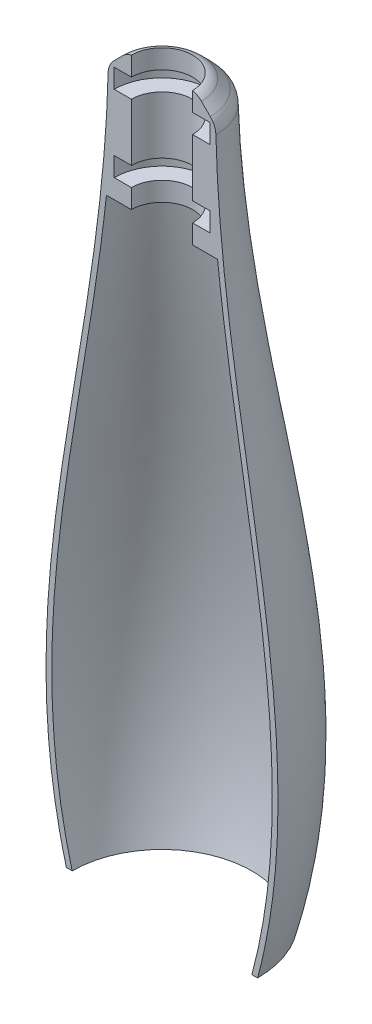
from build123d import *

# Parameters (mm, degrees)
CORTAR_EXTRUIR1_DEPTH      = 70
CORTAR_EXTRUIR1_DEPTH_BACK = 70
CROQUIS2_W                 = 77.259476102
CROQUIS2_H                 = 391.167224263
CHAFL_N1_SIZE              = 10
REDONDEO1_R                = 10


with BuildPart() as part:
    # Croquis1 → Revolución1 (revolve)
    with BuildSketch(Plane.XY):
        with BuildLine():
            Line((-28, 35), (-16, 35))
            Line((-16, 35), (-16, 25))
            Line((-16, 25), (-25, 25))
            Line((-25, 25), (-25, 15))
            Line((-25, 15), (-16, 15))
            Line((-16, 15), (-16, -15))
            Line((-16, -15), (-25, -15))
            Line((-25, -15), (-25, -25))
            Line((-25, -25), (-16, -25))
            Line((-16, -25), (-16, -35))
            Line((-16, -35), (-29.067033725, -35))
            add(Edge.make_bspline(
                [(-47, -350), (-74.627383194, -246.893202238), (-41.199250834, -146.705952206), (-29.067033725, -35)],
                knots=[0, 0, 0, 0, 0.830416843, 0.830416843, 0.830416843, 0.830416843], degree=3))
            Line((-47, -350), (-50, -350))
            add(Edge.make_bspline(
                [(-28, 35), (-28, -105.90833009), (-83.269295344, -225.837299443), (-50, -350)],
                knots=[0, 0, 0, 0, 1, 1, 1, 1], degree=3))
        make_face()
    revolve(axis=Axis((0, 50, 0), (0, -1, 0)))

    # Croquis2 → Cortar-Extruir1 (cut, two sides: drawn at the far end of the back side and taken through both)
    with BuildSketch(Plane(origin=(0, 0, 0), x_dir=(0, 0, -1), z_dir=(1, 0, 0)).offset(-CORTAR_EXTRUIR1_DEPTH_BACK)):
        with Locations((-38.629738051, -154.416387869)):
            Rectangle(CROQUIS2_W, CROQUIS2_H)
    extrude(amount=CORTAR_EXTRUIR1_DEPTH + CORTAR_EXTRUIR1_DEPTH_BACK, mode=Mode.SUBTRACT)

    # Chaflán1
    # the kernel refuses this chamfer: 10 mm, written as the material it takes off along each edge
    with BuildSketch(Plane(origin=(0, 35, 0), x_dir=(-0.5990091787085334, 0, 0.8007421581401396), z_dir=(0.8007421581401396, 0, 0.5990091787085334))) as chafl_n1_piece_1:
        with BuildLine():
            Line((28 - CHAFL_N1_SIZE, 0), (28.093218581, 10.093218581))
            ThreePointArc((28.093218581, 10.093218581), (28.024813117, 5.189585851), (28, 0))
            Line((28, 0), (28 - CHAFL_N1_SIZE, 0))
        make_face()
    revolve(axis=Axis((0, 35, 0), (0, -1, 0)), revolution_arc=286.402063585, mode=Mode.SUBTRACT)

    # Redondeo1
    # the kernel refuses this fillet: 10 mm, written as the material it takes off along each edge
    with BuildSketch(Plane(origin=(0, 24.906781419, 0), x_dir=(-0.9366579963611824, 0, 0.35024533951596737), z_dir=(0.35024533951596737, 0, 0.9366579963611824))) as redondeo1_piece_1:
        with BuildLine():
            CenterArc((18.183388392, 4.232305435), REDONDEO1_R, 315, 43.547945444)
            Line((28.180177192, 3.978901233), (28.380112968, 3.973833149))
            ThreePointArc((28.380112968, 3.973833149), (28.333165909, 1.985155745), (28.293184954, -0.003667366))
            Line((28.293184954, -0.003667366), (28.234639937, -0.141421356))
            Line((28.234639937, -0.141421356), (25.39587756, -2.980183733))
            Line((25.39587756, -2.980183733), (25.254456204, -2.838762377))
        make_face()
    revolve(axis=Axis((0, 24.906781419, 0), (0, -1, 0)), revolution_arc=221.004643811, mode=Mode.SUBTRACT)
    with BuildSketch(Plane(origin=(0, 35, 0), x_dir=(-0.8695683162103452, 0, 0.4938126602701729), z_dir=(0.4938126602701729, 0, 0.8695683162103452))) as redondeo1_piece_2:
        with BuildLine():
            CenterArc((13.554140544, 9.696276168), REDONDEO1_R, 284.157365729, 30.842634271)
            Line((20.625208356, 2.625208356), (20.766629712, 2.483787))
            Line((20.766629712, 2.483787), (18.141421356, -0.141421356))
            Line((18.141421356, -0.141421356), (18, -0.2))
            ThreePointArc((18, -0.2), (17, -0.2), (16.048917189, -0.193925523))
            Line((16.048917189, -0.193925523), (16, 0))
        make_face()
    revolve(axis=Axis((0, 35, 0), (0, -1, 0)), revolution_arc=239.182972496, mode=Mode.SUBTRACT)


solid = part.part
